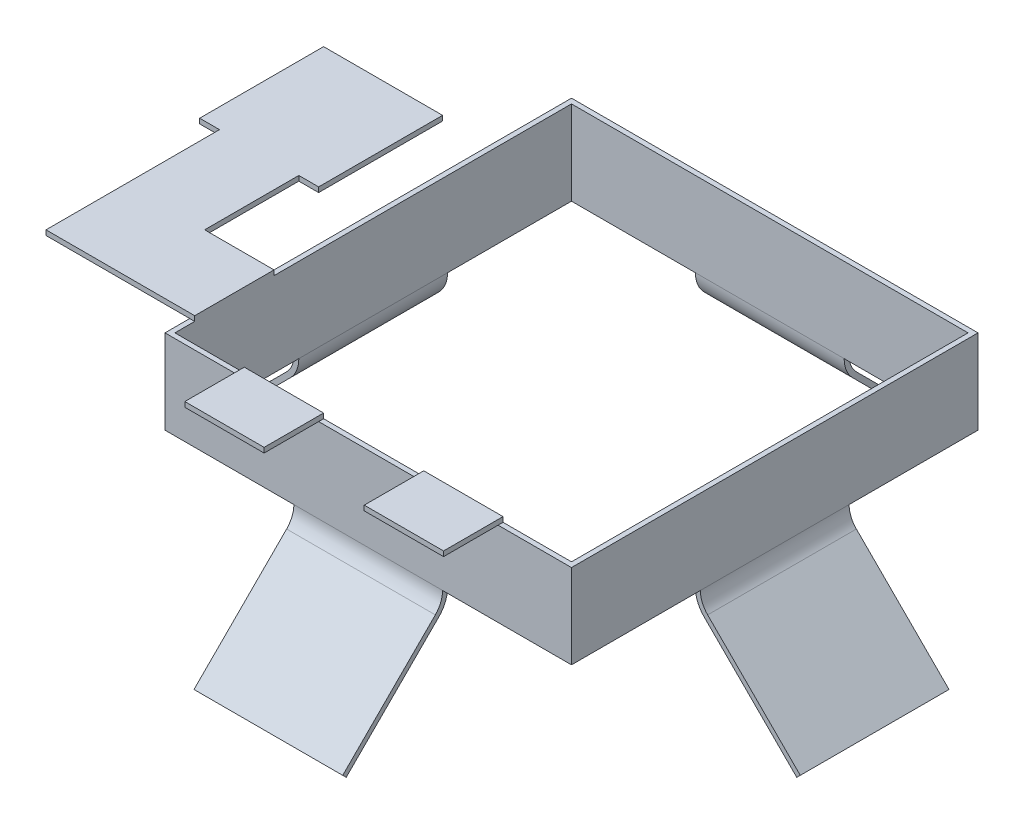
from build123d import *

# Parameters (mm, degrees)
SKETCH1_W           = 8.2
SKETCH1_H           = 8.2
SKETCH1_W_2         = 8
SKETCH1_H_2         = 8
BOSS_EXTRUDE1_DEPTH = 1.7
BOSS_EXTRUDE2_DEPTH = 1.5
CIRPATTERN1_COUNT   = 4
BOSS_EXTRUDE3_DEPTH = 0.1
SKETCH4_W           = 1.6
SKETCH4_H           = 1.2
BOSS_EXTRUDE4_DEPTH = 0.1


with BuildPart() as part:
    # Sketch1 → Boss-Extrude1 (new body)
    with BuildSketch(Plane(origin=(0, 0, 0), x_dir=(1, 0, 0), z_dir=(0, 1, 0))):
        Rectangle(SKETCH1_W, SKETCH1_H)
        Rectangle(SKETCH1_W_2, SKETCH1_H_2, mode=Mode.SUBTRACT)
    extrude(amount=BOSS_EXTRUDE1_DEPTH)

    # Sketch2 → Boss-Extrude2 (add, symmetric)
    with BuildSketch(Plane.ZY):
        with BuildLine():
            Line((6.115237938, -2.222344719), (4.246446609, -0.353553391))
            ThreePointArc((4.246446609, -0.353553391), (4.138060234, -0.191341716), (4.1, 0))
            Line((4.1, 0), (4.1, 0.022895615))
            Line((4.1, 0.022895615), (4, 0.022895615))
            Line((4, 0.022895615), (4, 0))
            ThreePointArc((4, 0), (4.04567228, -0.229610059), (4.175735931, -0.424264069))
            Line((4.175735931, -0.424264069), (6.04452726, -2.293055398))
            Line((6.04452726, -2.293055398), (6.115237938, -2.222344719))
        make_face()
    boss_extrude2 = extrude(amount=BOSS_EXTRUDE2_DEPTH, both=True)

    # CirPattern1: Boss-Extrude2 ×4 about axis
    cirpattern1_axis = Axis((0, -0.1, 0), (0, 1, 0))
    for i in range(1, CIRPATTERN1_COUNT):
        add(boss_extrude2.rotate(cirpattern1_axis, i * 360 / CIRPATTERN1_COUNT))

    # Sketch3 → Boss-Extrude3 (add)
    with BuildSketch(Plane(origin=(0, 1.7, 0), x_dir=(1, 0, 0), z_dir=(0, 1, 0))):
        Polygon((-4, -3.6), (-5.4, -3.6), (-7, -3.6), (-7, -0.1), (-7.400115841, -0.1), (-7.400115841, 2.4), (-7, 2.4), (-5.4, 2.4), (-5.000115841, 2.4), (-5.000115841, -0.1), (-5.4, -0.1), (-5.4, -2), (-4, -2), align=None)
    extrude(amount=BOSS_EXTRUDE3_DEPTH)

    # Sketch4 → Boss-Extrude4 (add)
    with BuildSketch(Plane(origin=(0, 1.7, 0), x_dir=(1, 0, 0), z_dir=(0, 1, 0))):
        with Locations((-1.8, -4.6)):
            Rectangle(SKETCH4_W, SKETCH4_H)
        with Locations((1.819415949, -4.6)):
            Rectangle(SKETCH4_W, SKETCH4_H)
    extrude(amount=BOSS_EXTRUDE4_DEPTH)


solid = part.part
